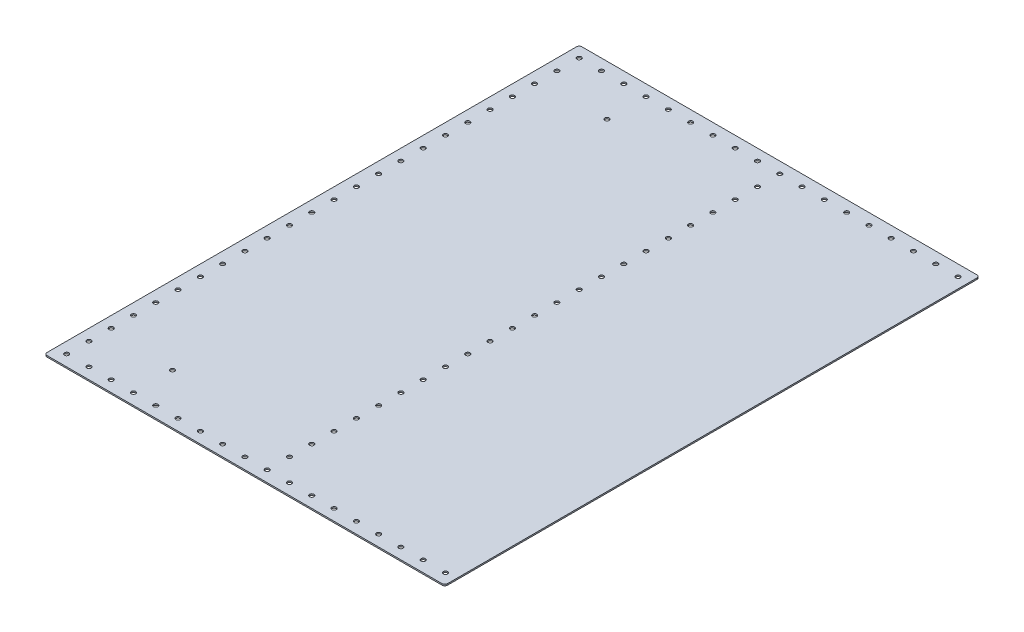
from build123d import *

# Parameters (mm, degrees)
SKETCH1_W           = 914.4
SKETCH1_H           = 609.6
BOSS_EXTRUDE1_DEPTH = 1.5875
SKETCH2_R           = 2.4892
CUT_EXTRUDE1_DEPTH  = 550.48830757
LPATTERN1_COUNT     = 24
LPATTERN1_PITCH     = 25.4
LPATTERN1_COL_COUNT = 36
LPATTERN1_COL_PITCH = 25.4
LPATTERN2_COUNT     = 23
LPATTERN2_PITCH     = 25.4
LPATTERN2_COL_COUNT = 35
LPATTERN2_COL_PITCH = 25.4
FILLET1_R           = 3.175
LPATTERN3_OUTLINE_R = 2.4892
LPATTERN3_DEPTH     = 1.5875
CUT_EXTRUDE2_REACH  = 551.488
SKETCH3_R           = 2.4892
SKETCH4_W           = 1.5875
SKETCH4_H           = 609.6
CUT_EXTRUDE3_DEPTH  = 550.48830757
FILLET2_R           = 3.175
FILLET3_R           = 3.175


# Read off the part's stored shape, not the designer's step: LPattern3
with BuildPart() as part:
    # Sketch1 → Boss-Extrude1 (new body)
    with BuildSketch(Plane(origin=(0, 0, 0), x_dir=(1, 0, 0), z_dir=(0, 1, 0))):
        Rectangle(SKETCH1_W, SKETCH1_H)
    extrude(amount=BOSS_EXTRUDE1_DEPTH)

    # Sketch2 → Cut-Extrude1 (cut, through all)
    with BuildSketch(Plane(origin=(0, 1.5875, 0), x_dir=(1, 0, 0), z_dir=(0, 1, 0))):
        with Locations(Location((-444.5, 292.1, 0), (0, 0, 270))):
            Circle(SKETCH2_R)
        with Locations(Location((444.5, -292.1, 0), (0, 0, 270))):
            Circle(SKETCH2_R)
    cut_extrude1 = extrude(amount=-CUT_EXTRUDE1_DEPTH, mode=Mode.SUBTRACT)

    # LPattern1: Cut-Extrude1 ×24
    with Locations(*[(0, 0, i * LPATTERN1_PITCH) for i in range(1, LPATTERN1_COUNT)]):
        add(cut_extrude1, mode=Mode.SUBTRACT)

    # LPattern1 col: Cut-Extrude1 ×36
    with Locations(*[(i * LPATTERN1_COL_PITCH, 0, 0) for i in range(1, LPATTERN1_COL_COUNT)]):
        add(cut_extrude1, mode=Mode.SUBTRACT)

    # LPattern2: Cut-Extrude1 ×23
    with Locations(*[(0, 0, -i * LPATTERN2_PITCH) for i in range(1, LPATTERN2_COUNT)]):
        add(cut_extrude1, mode=Mode.SUBTRACT)

    # LPattern2 col: Cut-Extrude1 ×35
    with Locations(*[(-i * LPATTERN2_COL_PITCH, 0, 0) for i in range(1, LPATTERN2_COL_COUNT)]):
        add(cut_extrude1, mode=Mode.SUBTRACT)

    # Fillet1
    fillet1_edges = [part.edges().sort_by_distance(p)[0] for p in [
        (-457.2, 0.79375, -304.8),
        (457.2, 0.79375, -304.8),
        (457.2, 0.79375, 304.8),
        (-457.2, 0.79375, 304.8),
    ]]
    fillet(fillet1_edges, radius=FILLET1_R)

    # LPattern3 outline → LPattern3 (cut)
    with BuildSketch(Plane(origin=(0, 0, 0), x_dir=(1, 0, 0), z_dir=(0, 1, 0))):
        with Locations((-215.9, 266.7)):
            Circle(LPATTERN3_OUTLINE_R)
        with Locations((215.9, 266.7)):
            Circle(LPATTERN3_OUTLINE_R)
        with Locations((-215.9, 241.3)):
            Circle(LPATTERN3_OUTLINE_R)
        with Locations((215.9, 241.3)):
            Circle(LPATTERN3_OUTLINE_R)
        with Locations((-215.9, 215.9)):
            Circle(LPATTERN3_OUTLINE_R)
        with Locations((215.9, 215.9)):
            Circle(LPATTERN3_OUTLINE_R)
        with Locations((-215.9, 190.5)):
            Circle(LPATTERN3_OUTLINE_R)
        with Locations((215.9, 190.5)):
            Circle(LPATTERN3_OUTLINE_R)
        with Locations((-215.9, 165.1)):
            Circle(LPATTERN3_OUTLINE_R)
        with Locations((215.9, 165.1)):
            Circle(LPATTERN3_OUTLINE_R)
        with Locations((-215.9, 139.7)):
            Circle(LPATTERN3_OUTLINE_R)
        with Locations((215.9, 139.7)):
            Circle(LPATTERN3_OUTLINE_R)
        with Locations((-215.9, 114.3)):
            Circle(LPATTERN3_OUTLINE_R)
        with Locations((215.9, 114.3)):
            Circle(LPATTERN3_OUTLINE_R)
        with Locations((-215.9, 88.9)):
            Circle(LPATTERN3_OUTLINE_R)
        with Locations((215.9, 88.9)):
            Circle(LPATTERN3_OUTLINE_R)
        with Locations((-215.9, 63.5)):
            Circle(LPATTERN3_OUTLINE_R)
        with Locations((215.9, 63.5)):
            Circle(LPATTERN3_OUTLINE_R)
        with Locations((-215.9, 38.1)):
            Circle(LPATTERN3_OUTLINE_R)
        with Locations((215.9, 38.1)):
            Circle(LPATTERN3_OUTLINE_R)
        with Locations((-215.9, 12.7)):
            Circle(LPATTERN3_OUTLINE_R)
        with Locations((215.9, 12.7)):
            Circle(LPATTERN3_OUTLINE_R)
        with Locations((-215.9, -12.7)):
            Circle(LPATTERN3_OUTLINE_R)
        with Locations((215.9, -12.7)):
            Circle(LPATTERN3_OUTLINE_R)
        with Locations((-215.9, -38.1)):
            Circle(LPATTERN3_OUTLINE_R)
        with Locations((215.9, -38.1)):
            Circle(LPATTERN3_OUTLINE_R)
        with Locations((-215.9, -63.5)):
            Circle(LPATTERN3_OUTLINE_R)
        with Locations((215.9, -63.5)):
            Circle(LPATTERN3_OUTLINE_R)
        with Locations((-215.9, -88.9)):
            Circle(LPATTERN3_OUTLINE_R)
        with Locations((215.9, -88.9)):
            Circle(LPATTERN3_OUTLINE_R)
        with Locations((-215.9, -114.3)):
            Circle(LPATTERN3_OUTLINE_R)
        with Locations((215.9, -114.3)):
            Circle(LPATTERN3_OUTLINE_R)
        with Locations((-215.9, -139.7)):
            Circle(LPATTERN3_OUTLINE_R)
        with Locations((215.9, -139.7)):
            Circle(LPATTERN3_OUTLINE_R)
        with Locations((-215.9, -165.1)):
            Circle(LPATTERN3_OUTLINE_R)
        with Locations((215.9, -165.1)):
            Circle(LPATTERN3_OUTLINE_R)
        with Locations((-215.9, -190.5)):
            Circle(LPATTERN3_OUTLINE_R)
        with Locations((215.9, -190.5)):
            Circle(LPATTERN3_OUTLINE_R)
        with Locations((-215.9, -215.9)):
            Circle(LPATTERN3_OUTLINE_R)
        with Locations((215.9, -215.9)):
            Circle(LPATTERN3_OUTLINE_R)
        with Locations((-215.9, -241.3)):
            Circle(LPATTERN3_OUTLINE_R)
        with Locations((215.9, -241.3)):
            Circle(LPATTERN3_OUTLINE_R)
        with Locations((-215.9, -266.7)):
            Circle(LPATTERN3_OUTLINE_R)
        with Locations((215.9, -266.7)):
            Circle(LPATTERN3_OUTLINE_R)
    extrude(amount=LPATTERN3_DEPTH, mode=Mode.SUBTRACT)

    # Sketch3 → Cut-Extrude2 (cut, up to next)
    with BuildSketch(Plane.XZ, mode=Mode.PRIVATE) as cut_extrude2_sk1:
        with Locations(Location((368.3, 247.65, 0), (0, 0, 270))):
            Circle(SKETCH3_R)
    cut_extrude2_tool1 = extrude(cut_extrude2_sk1.sketch, amount=-CUT_EXTRUDE2_REACH, mode=Mode.PRIVATE) & part.part
    # Sketch3 → Cut-Extrude2 (cut, up to next)
    with BuildSketch(Plane.XZ, mode=Mode.PRIVATE) as cut_extrude2_sk2:
        with Locations(Location((368.3, -247.65, 0), (0, 0, 270))):
            Circle(SKETCH3_R)
    cut_extrude2_tool2 = extrude(cut_extrude2_sk2.sketch, amount=-CUT_EXTRUDE2_REACH, mode=Mode.PRIVATE) & part.part
    # Sketch3 → Cut-Extrude2 (cut, up to next)
    with BuildSketch(Plane.XZ, mode=Mode.PRIVATE) as cut_extrude2_sk3:
        with Locations(Location((-368.3, -247.65, 0), (0, 0, 270))):
            Circle(SKETCH3_R)
    cut_extrude2_tool3 = extrude(cut_extrude2_sk3.sketch, amount=-CUT_EXTRUDE2_REACH, mode=Mode.PRIVATE) & part.part
    # Sketch3 → Cut-Extrude2 (cut, up to next)
    with BuildSketch(Plane.XZ, mode=Mode.PRIVATE) as cut_extrude2_sk4:
        with Locations(Location((-368.3, 247.65, 0), (0, 0, 270))):
            Circle(SKETCH3_R)
    cut_extrude2_tool4 = extrude(cut_extrude2_sk4.sketch, amount=-CUT_EXTRUDE2_REACH, mode=Mode.PRIVATE) & part.part
    add(cut_extrude2_tool1.solids().sort_by_distance((368.3, 0, 247.65))[0], mode=Mode.SUBTRACT)
    add(cut_extrude2_tool2.solids().sort_by_distance((368.3, 0, -247.65))[0], mode=Mode.SUBTRACT)
    add(cut_extrude2_tool3.solids().sort_by_distance((-368.3, 0, -247.65))[0], mode=Mode.SUBTRACT)
    add(cut_extrude2_tool4.solids().sort_by_distance((-368.3, 0, 247.65))[0], mode=Mode.SUBTRACT)

    # Sketch4 → Cut-Extrude3 (cut, through all)
    with BuildSketch(Plane(origin=(0, 1.5875, 0), x_dir=(1, 0, 0), z_dir=(0, 1, 0))):
        Rectangle(SKETCH4_W, SKETCH4_H)
    extrude(amount=-CUT_EXTRUDE3_DEPTH, mode=Mode.SUBTRACT)


with BuildPart() as cut_extrude3_piece_1:
    # of the separate pieces the step leaves, piece 1, a body of its own (cut_extrude3_pieces)
    add(part.part.solids().sort_by_distance((454.025, 0, 304.8))[0])

    # Fillet3
    fillet3_edges = [cut_extrude3_piece_1.edges().sort_by_distance(p)[0] for p in [
        (0.79375, 0.79375, -304.8),
        (0.79375, 0.79375, 304.8),
    ]]
    fillet(fillet3_edges, radius=FILLET3_R)


with BuildPart() as cut_extrude3_piece_2:
    # of the separate pieces the step leaves, piece 2, a body of its own (cut_extrude3_pieces)
    add(part.part.solids().sort_by_distance((-0.79375, 0, 304.8))[0])

    # Fillet2
    fillet2_edges = [cut_extrude3_piece_2.edges().sort_by_distance(p)[0] for p in [
        (-0.79375, 0.79375, 304.8),
        (-0.79375, 0.79375, -304.8),
    ]]
    fillet(fillet2_edges, radius=FILLET2_R)


solid = cut_extrude3_piece_2.part
